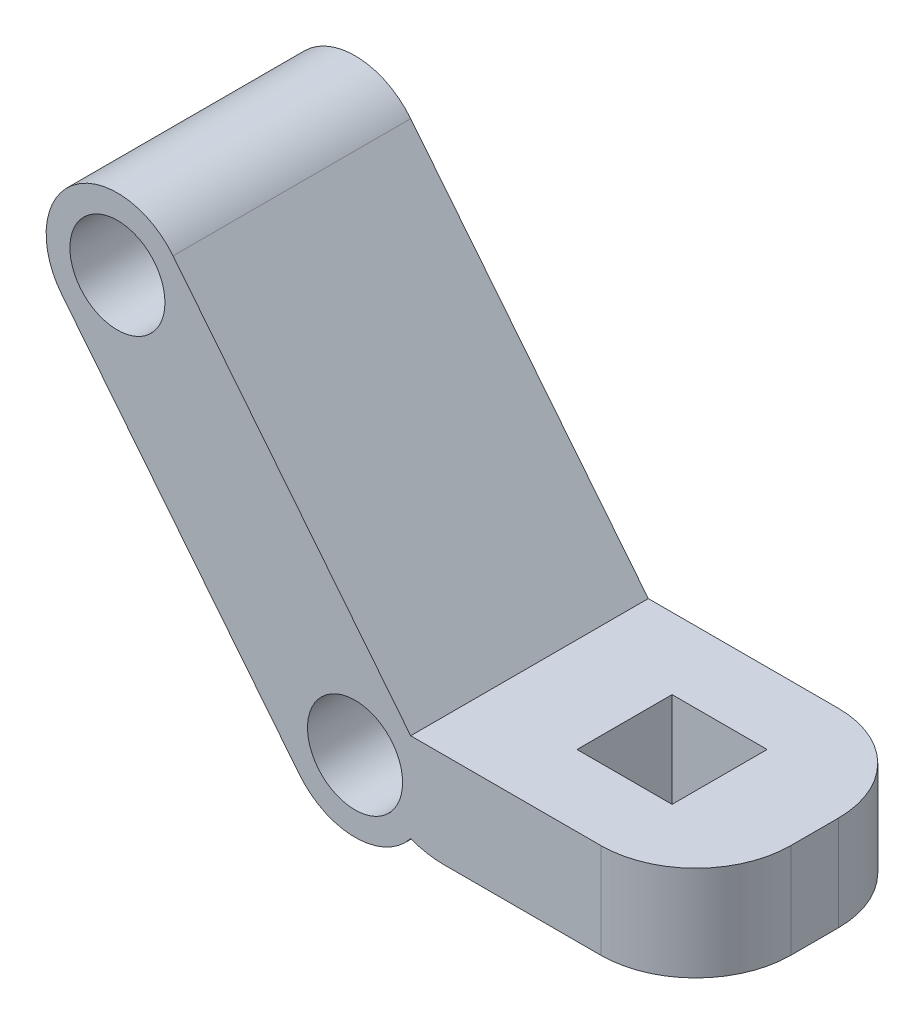
from build123d import *

# Parameters (mm, degrees)
EXTRUDE_1_DEPTH     = 25
SKETCH_2_R          = 5
CUT_EXTRUDE_1_DEPTH = 58.049387676
SKETCH_6_W          = 30
SKETCH_6_H          = 25
EXTRUDE_2_DEPTH     = 10
SKETCH_7_W          = 10
SKETCH_7_H          = 10
CUT_EXTRUDE_2_DEPTH = 10
FILLET_1_R          = 10
FILLET_2_R          = 10


with BuildPart() as part:
    # 草图1 → 凸台-拉伸1 (new body)
    with BuildSketch(Plane.XY):
        with BuildLine():
            Line((-25, 31.224989992), (0, 0))
            ThreePointArc((0, 0), (-1.167185623, -10.542185623), (-11.709371247, -9.375))
            Line((-11.709371247, -9.375), (-36.709371247, 21.849989992))
            ThreePointArc((-36.709371247, 21.849989992), (-35.542185623, 32.392175615), (-25, 31.224989992))
        make_face()
    extrude(amount=EXTRUDE_1_DEPTH)

    # 草图2 → 切除-拉伸1 (cut, through all)
    with BuildSketch(Plane.XY.offset(25)):
        with Locations((-30.854685623, 26.537489992)):
            Circle(SKETCH_2_R)
        with Locations((-5.854685623, -4.6875)):
            Circle(SKETCH_2_R)
    extrude(amount=-CUT_EXTRUDE_1_DEPTH, mode=Mode.SUBTRACT)

    # 草图6 → 凸台-拉伸2 (add)
    with BuildSketch(Plane(origin=(0, 0, 0), x_dir=(1, 0, 0), z_dir=(0, 1, 0))):
        with Locations((15, -12.5)):
            Rectangle(SKETCH_6_W, SKETCH_6_H)
    extrude(amount=-EXTRUDE_2_DEPTH)

    # 草图7 → 切除-拉伸2 (cut)
    with BuildSketch(Plane(origin=(0, 0, 0), x_dir=(1, 0, 0), z_dir=(0, 1, 0))):
        with Locations((15, -12.5)):
            Rectangle(SKETCH_7_W, SKETCH_7_H)
    extrude(amount=-CUT_EXTRUDE_2_DEPTH, mode=Mode.SUBTRACT)

    # 圆角1
    fillet_1_edges = [part.edges().sort_by_distance(p)[0] for p in [
        (30, -5, 0),
        (30, -5, 25),
    ]]
    fillet(fillet_1_edges, radius=FILLET_1_R)

    # 圆角2
    # the kernel refuses this fillet: 10 mm, written as the material it takes off along each edge
    with BuildSketch(Plane(origin=(0, -10, 33.699631817), x_dir=(1, 0, 0), z_dir=(0, 0, -1))) as fillet_2_piece_1:
        with BuildLine():
            CenterArc((3.479852727, -10), FILLET_2_R, 90, 20.364134806)
            Line((0, -0.625), (-0.069597055, -0.4375))
            ThreePointArc((-0.069597055, -0.4375), (-0.2, -0.3125), (-0.2, 0))
            Line((-0.2, 0), (0, 0.2))
            Line((0, 0.2), (3.479852727, 0.2))
            Line((3.479852727, 0.2), (3.479852727, 0))
        make_face()
    extrude(amount=42.399263634, mode=Mode.SUBTRACT)


solid = part.part
